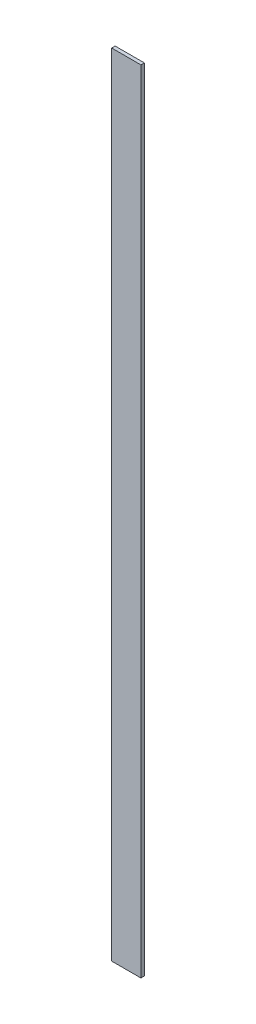
from build123d import *

# Parameters (mm, degrees)
SKETCH1_W          = 8.5
SKETCH1_H          = 230
BASE_FLANGE1_DEPTH = 1


# Sheet-metal steps are written as plain solids
with BuildPart() as part:
    # Sketch1 → Base-Flange1 (new body)
    with BuildSketch(Plane.XY):
        with Locations((0.453883495, -99.196601942)):
            Rectangle(SKETCH1_W, SKETCH1_H)
    extrude(amount=-BASE_FLANGE1_DEPTH)


solid = part.part
